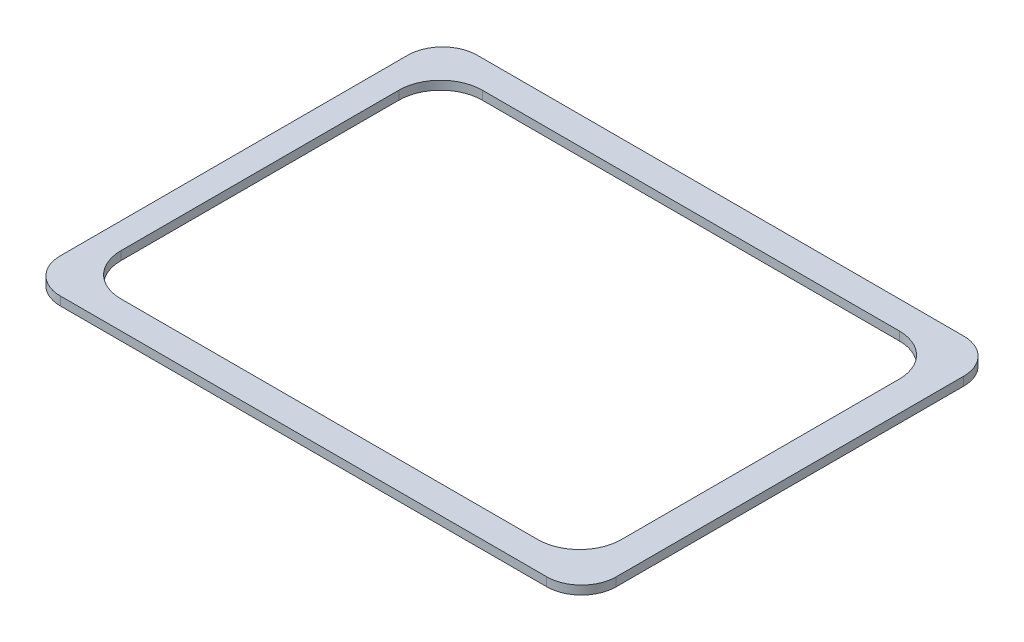
from build123d import *

# Parameters (mm, degrees)
FRONTFACE_DEPTH = 3.175


with BuildPart() as part:
    # Sketch1 → FrontFace (new body)
    with BuildSketch(Plane(origin=(0, 7.52475, 0), x_dir=(-1, 0, 0), z_dir=(0, 1, 0))):
        with BuildLine():
            Line((-101.6, 63.5), (-101.6, -63.5))
            ThreePointArc((-101.6, -63.5), (-97.880256121, -72.480256121), (-88.9, -76.2))
            Line((-88.9, -76.2), (88.9, -76.2))
            ThreePointArc((88.9, -76.2), (97.880256121, -72.480256121), (101.6, -63.5))
            Line((101.6, -63.5), (101.6, 63.5))
            ThreePointArc((101.6, 63.5), (97.880256121, 72.480256121), (88.9, 76.2))
            Line((88.9, 76.2), (-88.9, 76.2))
            ThreePointArc((-88.9, 76.2), (-97.880256121, 72.480256121), (-101.6, 63.5))
        make_face()
        with BuildLine():
            Line((-90.750003, 50.8), (-90.750003, 0))
            Line((-90.750003, 0), (-90.750003, -50.8))
            ThreePointArc((-90.750003, -50.8), (-86.283380534, -61.583380534), (-75.5, -66.050003))
            Line((-75.5, -66.050003), (76.9, -66.050003))
            ThreePointArc((76.9, -66.050003), (87.683380534, -61.583380534), (92.150003, -50.8))
            Line((92.150003, -50.8), (92.150003, 50.8))
            ThreePointArc((92.150003, 50.8), (87.683380534, 61.583380534), (76.9, 66.050003))
            Line((76.9, 66.050003), (-75.5, 66.050003))
            ThreePointArc((-75.5, 66.050003), (-86.283380534, 61.583380534), (-90.750003, 50.8))
        make_face(mode=Mode.SUBTRACT)
    extrude(amount=FRONTFACE_DEPTH)


solid = part.part
